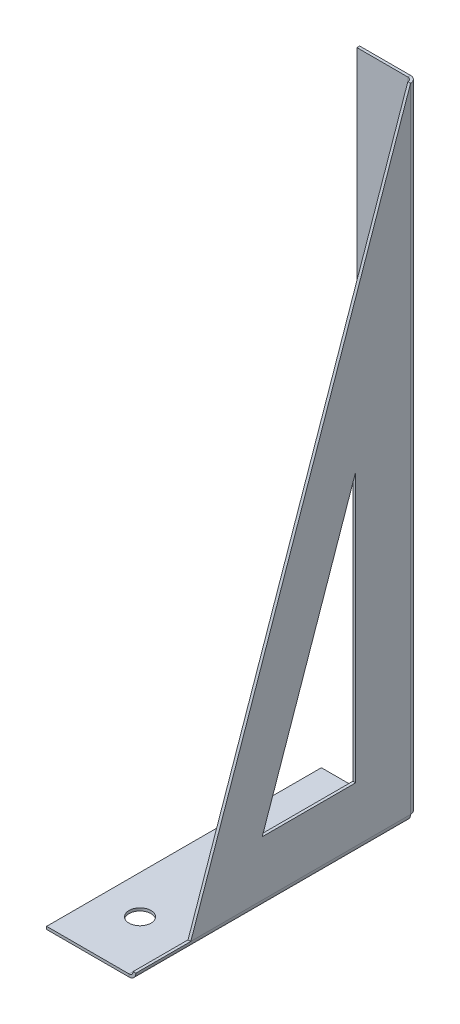
from build123d import *

# Parameters (mm, degrees)
SKETCH2_W          = 15
SKETCH2_H          = 50
BASE_FLANGE1_DEPTH = 0.5
EDGE_FLANGE1_DEPTH = 50
CUT_EXTRUDE1_DEPTH = 10
CUT_EXTRUDE2_DEPTH = 10
SKETCH22_R         = 2
CUT_EXTRUDE3_DEPTH = 10
EDGE_FLANGE2_DEPTH = 115.2634


# Sheet-metal steps are written as plain solids
with BuildPart() as part:
    # Sketch2 → Base-Flange1 (new body)
    with BuildSketch(Plane(origin=(0, 0, 0), x_dir=(1, 0, 0), z_dir=(0, 1, 0))):
        with Locations((-7.5, -25)):
            Rectangle(SKETCH2_W, SKETCH2_H)
    extrude(amount=-BASE_FLANGE1_DEPTH)

    # Edge-Flange1 section (across the edge) → Edge-Flange1 (add)
    with BuildSketch(Plane(origin=(0.7366, 0, 50), x_dir=(-1, 0, 0), z_dir=(0, 0, -1))):
        with BuildLine():
            Line((-0.5, 0.7366), (-0.5, 116))
            Line((-0.5, 116), (0, 116))
            Line((0, 116), (0, 0.7366))
            ThreePointArc((0, 0.7366), (0.215745145, 0.215745145), (0.7366, 0))
            Line((0.7366, 0), (0.7366, -0.5))
            ThreePointArc((0.7366, -0.5), (-0.137808246, -0.137808246), (-0.5, 0.7366))
        make_face()
    extrude(amount=EDGE_FLANGE1_DEPTH)

    # Sketch19 → Cut-Extrude1 (cut)
    with BuildSketch(Plane.ZY.offset(-0.7366)):
        Polygon((50, 0.7366), (40, 0.7366), (0, 116), (50, 116), align=None)
    extrude(amount=-CUT_EXTRUDE1_DEPTH, mode=Mode.SUBTRACT)

    # Sketch21 → Cut-Extrude2 (cut)
    with BuildSketch(Plane.ZY.offset(-0.7366)):
        Polygon((10, 10.7366), (10, 59.7366), (27, 10.7366), align=None)
    extrude(amount=-CUT_EXTRUDE2_DEPTH, mode=Mode.SUBTRACT)

    # Sketch22 → Cut-Extrude3 (cut)
    with BuildSketch(Plane(origin=(0, 0, 0), x_dir=(1, 0, 0), z_dir=(0, 1, 0))):
        with Locations(Location((-8, -40, 0), (0, 0, 270))):
            Circle(SKETCH22_R)
        with Locations(Location((-8, -7, 0), (0, 0, 270))):
            Circle(SKETCH22_R)
    extrude(amount=-CUT_EXTRUDE3_DEPTH, mode=Mode.SUBTRACT)

    # Edge-Flange2 section (across the edge) → Edge-Flange2 (add)
    with BuildSketch(Plane(origin=(0.7366, 116, -0.7366), x_dir=(0, 0, 1), z_dir=(0, -1, 0))):
        with BuildLine():
            Line((-0.5, 0.7366), (-0.5, 10))
            Line((-0.5, 10), (0, 10))
            Line((0, 10), (0, 0.7366))
            ThreePointArc((0, 0.7366), (0.215745145, 0.215745145), (0.7366, 0))
            Line((0.7366, 0), (0.7366, -0.5))
            ThreePointArc((0.7366, -0.5), (-0.137808246, -0.137808246), (-0.5, 0.7366))
        make_face()
    extrude(amount=EDGE_FLANGE2_DEPTH)


solid = part.part
